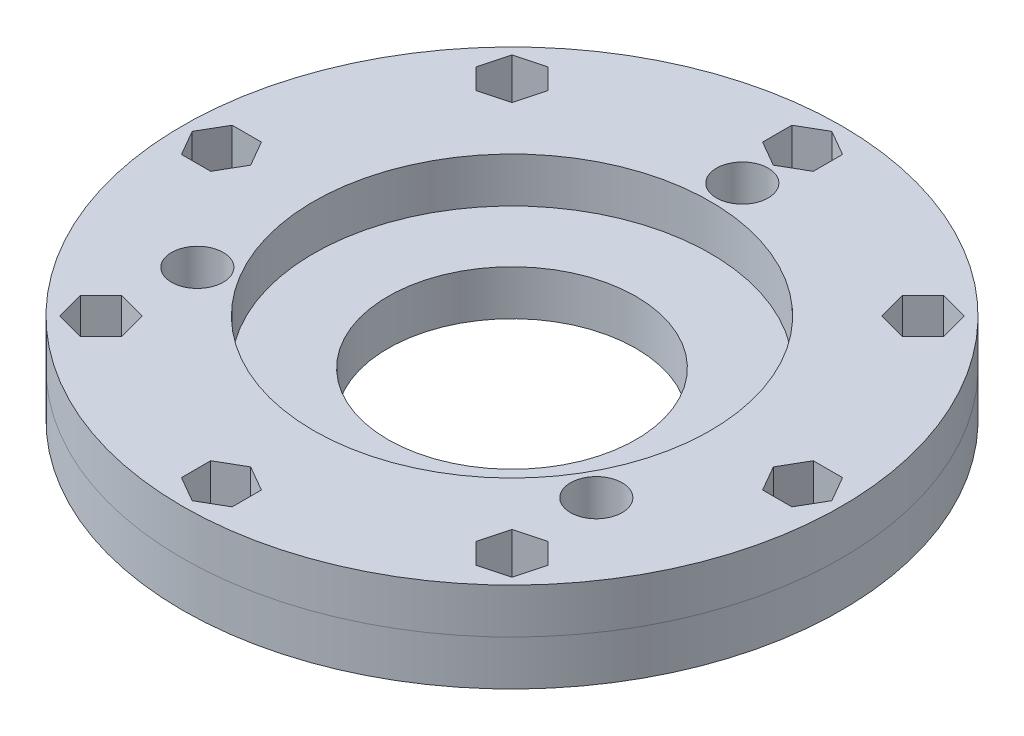
from build123d import *

# Parameters (mm, degrees)
SKETCH1_R           = 46.5
SKETCH1_R_2         = 2.5
SKETCH1_R_3         = 17.5
BOSS_EXTRUDE1_DEPTH = 12.7
SKETCH2_R           = 28
CUT_EXTRUDE1_DEPTH  = 6.35
SKETCH3_R           = 2.5
CUT_EXTRUDE2_DEPTH  = 6.35
SKETCH4_R           = 3.65
CUT_EXTRUDE3_DEPTH  = 6.35


with BuildPart() as part:
    # Sketch1 → Boss-Extrude1 (new body)
    with BuildSketch(Plane(origin=(0, 0, 0), x_dir=(1, 0, 0), z_dir=(0, 1, 0))):
        Circle(SKETCH1_R)
        with Locations((0, 32.5)):
            Circle(SKETCH1_R_2, mode=Mode.SUBTRACT)
        with Locations((28.145825623, -16.25)):
            Circle(SKETCH1_R_2, mode=Mode.SUBTRACT)
        with Locations((-28.145825623, -16.25)):
            Circle(SKETCH1_R_2, mode=Mode.SUBTRACT)
        Circle(SKETCH1_R_3, mode=Mode.SUBTRACT)
    extrude(amount=BOSS_EXTRUDE1_DEPTH)

    # Sketch2 → Cut-Extrude1 (cut)
    with BuildSketch(Plane(origin=(0, 12.7, 0), x_dir=(1, 0, 0), z_dir=(0, 1, 0))):
        Circle(SKETCH2_R)
    extrude(amount=-CUT_EXTRUDE1_DEPTH, mode=Mode.SUBTRACT)

    # Sketch3 → Cut-Extrude2 (cut)
    with BuildSketch(Plane(origin=(0, 12.7, 0), x_dir=(1, 0, 0), z_dir=(0, 1, 0))):
        with Locations((0, 41)):
            Circle(SKETCH3_R)
        with Locations((28.991378029, 28.991378029)):
            Circle(SKETCH3_R)
        with Locations((41, 0)):
            Circle(SKETCH3_R)
        with Locations((28.991378029, -28.991378029)):
            Circle(SKETCH3_R)
        with Locations((0, -41)):
            Circle(SKETCH3_R)
        with Locations((-28.991378029, -28.991378029)):
            Circle(SKETCH3_R)
        with Locations((-41, 0)):
            Circle(SKETCH3_R)
        with Locations((-28.991378029, 28.991378029)):
            Circle(SKETCH3_R)
    extrude(amount=-CUT_EXTRUDE2_DEPTH, mode=Mode.SUBTRACT)

    # Sketch4 → Cut-Extrude3 (cut)
    with BuildSketch(Plane(origin=(0, 12.7, 0), x_dir=(1, 0, 0), z_dir=(0, 1, 0))):
        with Locations((0, 32.5)):
            Circle(SKETCH4_R)
        with Locations((28.145825623, -16.25)):
            Circle(SKETCH4_R)
        with Locations((-28.145825623, -16.25)):
            Circle(SKETCH4_R)
        Polygon((0, 45.128054425), (-3.575, 43.064027212), (-3.575, 38.935972788), (0, 36.871945575), (3.575, 38.935972788), (3.575, 43.064027212), align=None)
        Polygon((32.97877241, 27.922958924), (31.910353305, 31.910353305), (27.922958924, 32.97877241), (25.003983647, 30.059797133), (26.072402752, 26.072402752), (30.059797133, 25.003983647), align=None)
        Polygon((43.064027212, -3.575), (45.128054425, 0), (43.064027212, 3.575), (38.935972788, 3.575), (36.871945575, 0), (38.935972788, -3.575), align=None)
        Polygon((27.922958924, -32.97877241), (31.910353305, -31.910353305), (32.97877241, -27.922958924), (30.059797133, -25.003983647), (26.072402752, -26.072402752), (25.003983647, -30.059797133), align=None)
        Polygon((-3.575, -43.064027212), (0, -45.128054425), (3.575, -43.064027212), (3.575, -38.935972788), (0, -36.871945575), (-3.575, -38.935972788), align=None)
        Polygon((-32.97877241, -27.922958924), (-31.910353305, -31.910353305), (-27.922958924, -32.97877241), (-25.003983647, -30.059797133), (-26.072402752, -26.072402752), (-30.059797133, -25.003983647), align=None)
        Polygon((-43.064027212, 3.575), (-45.128054425, 0), (-43.064027212, -3.575), (-38.935972788, -3.575), (-36.871945575, 0), (-38.935972788, 3.575), align=None)
        Polygon((-27.922958924, 32.97877241), (-31.910353305, 31.910353305), (-32.97877241, 27.922958924), (-30.059797133, 25.003983647), (-26.072402752, 26.072402752), (-25.003983647, 30.059797133), align=None)
    extrude(amount=-CUT_EXTRUDE3_DEPTH, mode=Mode.SUBTRACT)


with BuildPart() as body_2:
    # Split1: the piece on the far side of the plane
    add(part.part)
    split(bisect_by=Plane.ZX.offset(6.35), keep=Keep.BOTTOM)


with BuildPart() as part_1:
    add(part.part)

    # Split1
    split(bisect_by=Plane.ZX.offset(6.35), keep=Keep.TOP)


solid = Compound([body_2.part, part_1.part])
